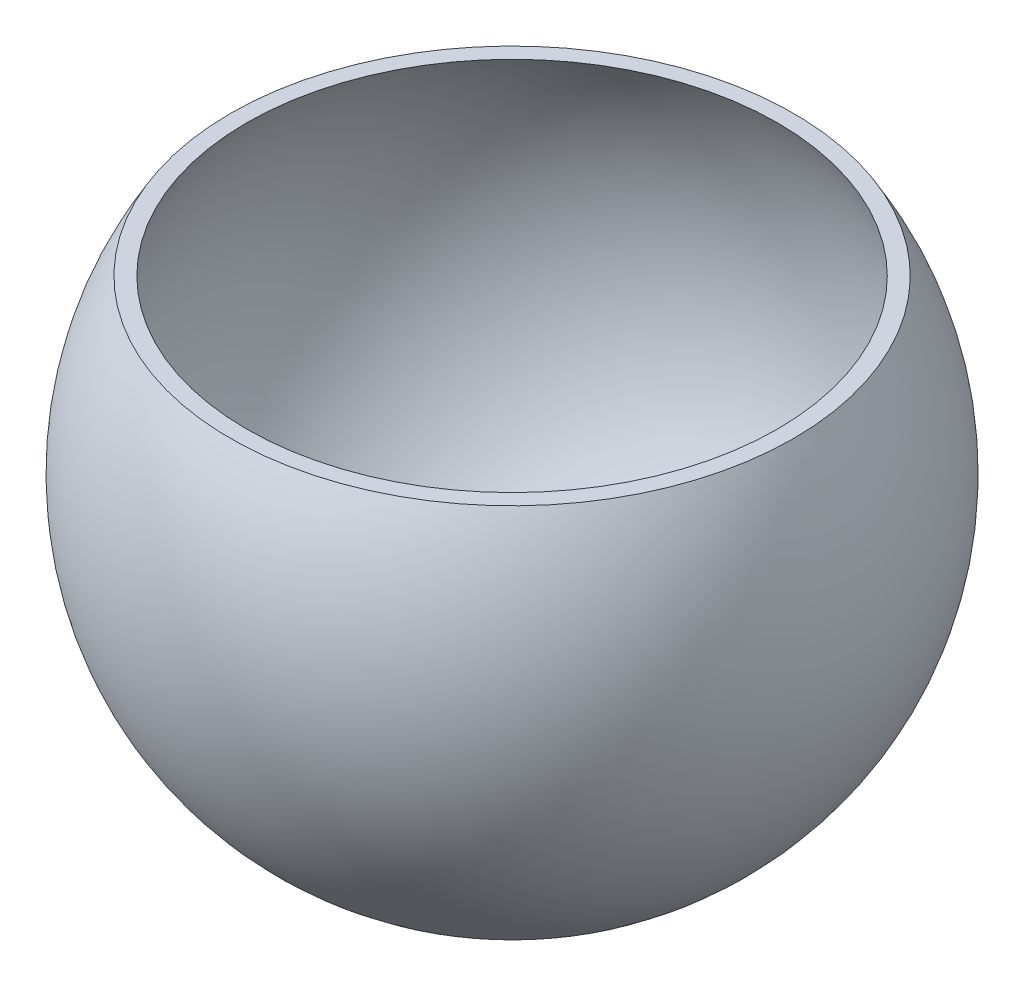
from build123d import *


with BuildPart() as part:
    # Sketch1 → Revolve1 (revolve)
    with BuildSketch(Plane.XY):
        with BuildLine():
            Line((130.175, 141.992101803), (122.679962198, 141.992101803))
            ThreePointArc((122.679962198, 141.992101803), (128.266827429, -7.100076667), (0, -83.305796435))
            Line((0, -83.305796435), (0, -89.655796435))
            ThreePointArc((0, -89.655796435), (132.859210617, -11.916295725), (130.175, 141.992101803))
        make_face()
    revolve(axis=Axis((0, 0, 0), (0, -1, 0)))


solid = part.part
